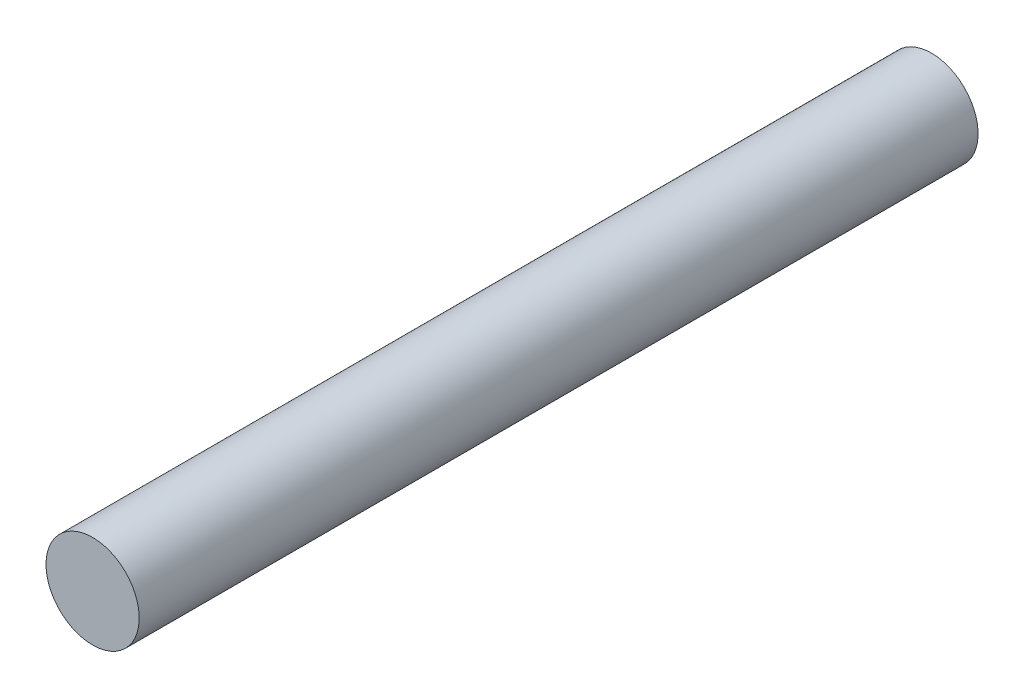
from build123d import *

# Parameters (mm, degrees)
SKETCH_1_R      = 5
EXTRUDE_1_DEPTH = 90


with BuildPart() as part:
    # 草图1 → 凸台-拉伸1 (new body)
    with BuildSketch(Plane.XY):
        Circle(SKETCH_1_R)
    extrude(amount=EXTRUDE_1_DEPTH)


solid = part.part
